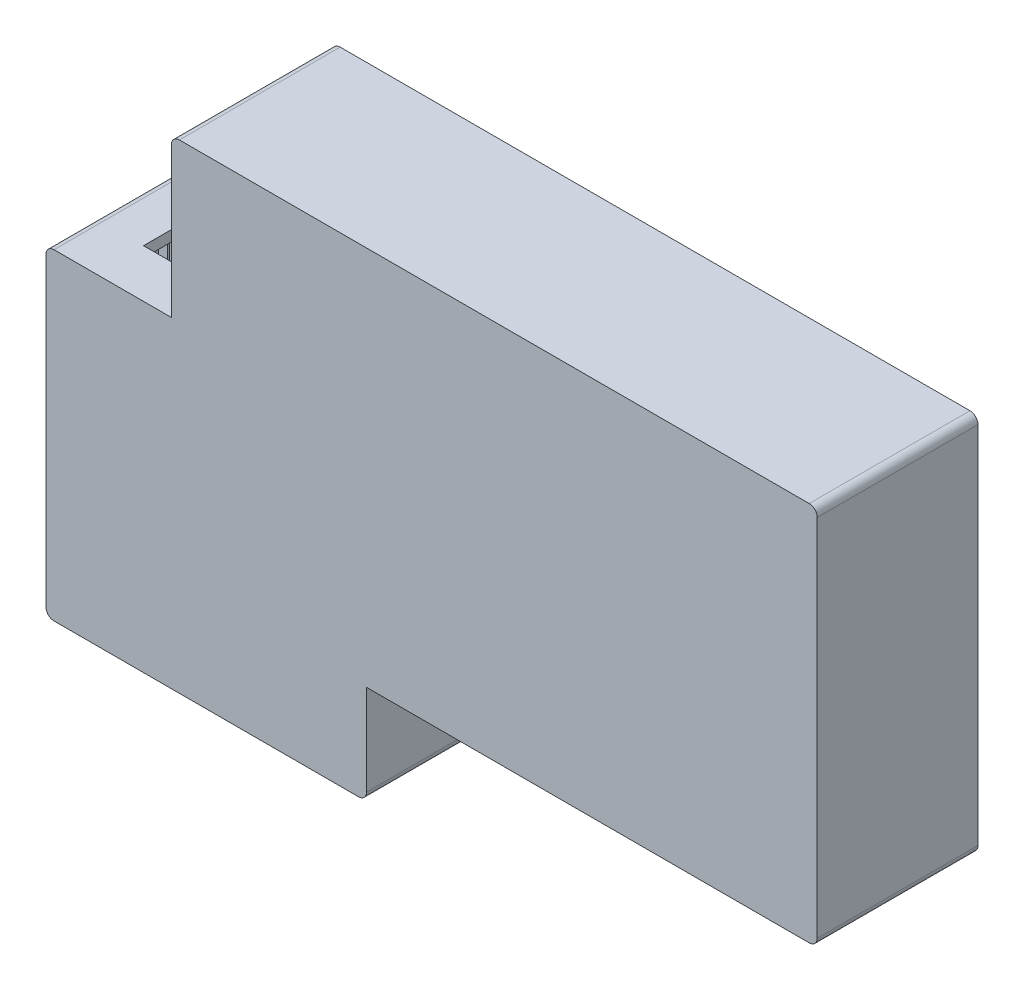
from build123d import *
from OCP.BRepFilletAPI import BRepFilletAPI_MakeChamfer

# Parameters (mm, degrees)
SKETCH1_R                = 2.5
SKETCH1_R_2              = 3.5
BASE_DEPTH               = 2
SKETCH1_3_R              = 0.75
SKETCH1_3_R_2            = 2.5
SKETCH1_3_R_3            = 1
SKETCH1_3_R_4            = 3.5
SKETCH1_3_R_5            = 1.25
PEGS_DEPTH               = 5
FILLET1_R                = 1.5
BOSS_EXTRUDE1_DEPTH      = 2
BOSS_EXTRUDE1_DEPTH_BACK = 9
BOSS_EXTRUDE2_START      = -9
BOSS_EXTRUDE2_DEPTH      = 2
BOSS_EXTRUDE3_START      = -8
BOSS_EXTRUDE3_DEPTH      = 8
FILLET2_R                = 1.5
CHAMFER1_SIZE            = 1
CHAMFER1_SIZE2           = 0.363970234
BOSS_EXTRUDE4_DEPTH      = 19
BOSS_EXTRUDE4_DEPTH_BACK = 9
BOSS_EXTRUDE5_START      = 19
BOSS_EXTRUDE5_DEPTH      = 2
CUT_EXTRUDE1_START       = -20.44
SKETCH2_W                = 13
SKETCH2_H                = 8
SKETCH2_R                = 5
CUT_EXTRUDE1_DEPTH       = 20.44
CUT_EXTRUDE2_START       = -60
SKETCH2_3_W              = 13
SKETCH2_3_H              = 8
CUT_EXTRUDE2_DEPTH       = 2
FILLET3_R                = 1.5
SKETCH3_W                = 3
SKETCH3_H                = 6
SKETCH3_H_2              = 5
SKETCH3_W_2              = 12
SKETCH3_H_3              = 3
SKETCH3_W_3              = 14
BOSS_EXTRUDE6_DEPTH      = 17


with BuildPart() as part:
    # Sketch1 → base (new body)
    with BuildSketch(Plane.XY):
        with BuildLine():
            Line((-33.06, 4.15), (-37.56, 4.15))
            Line((-37.56, 4.15), (-37.56, -47.85))
            Line((-37.56, -47.85), (12.255, -47.85))
            Line((12.255, -47.85), (12.255, -29.41))
            Line((12.255, -29.41), (98.36, -29.41))
            Line((98.36, -29.41), (98.36, 33.59))
            Line((98.36, 33.59), (-14.16, 33.59))
            Line((-14.16, 33.59), (-14.16, 4.15))
            Line((-14.16, 4.15), (-18.66, 4.15))
            ThreePointArc((-18.66, 4.15), (-20.16, -0.35), (-21.66, 4.15))
            Line((-21.66, 4.15), (-30.06, 4.15))
            ThreePointArc((-30.06, 4.15), (-31.56, -0.35), (-33.06, 4.15))
        make_face()
        with Locations((18.16, -25.41)):
            Circle(SKETCH1_R, mode=Mode.SUBTRACT)
        with Locations((94.36, -25.41)):
            Circle(SKETCH1_R, mode=Mode.SUBTRACT)
        with Locations((94.36, -9.41)):
            Circle(SKETCH1_R, mode=Mode.SUBTRACT)
        with Locations((79.16, 29.59)):
            Circle(SKETCH1_R_2, mode=Mode.SUBTRACT)
        with Locations((18.16, 29.59)):
            Circle(SKETCH1_R_2, mode=Mode.SUBTRACT)
        with Locations((10.16, 29.59)):
            Circle(SKETCH1_R, mode=Mode.SUBTRACT)
        with Locations((-10.16, 29.59)):
            Circle(SKETCH1_R, mode=Mode.SUBTRACT)
        with Locations((-10.16, 14.35)):
            Circle(SKETCH1_R, mode=Mode.SUBTRACT)
        with Locations((-10.16, 6.35)):
            Circle(SKETCH1_R, mode=Mode.SUBTRACT)
        with Locations((8.255, -44.85)):
            Circle(SKETCH1_R, mode=Mode.SUBTRACT)
        with Locations((-8.255, -44.85)):
            Circle(SKETCH1_R, mode=Mode.SUBTRACT)
        with Locations((-20.16, -44.85)):
            Circle(SKETCH1_R, mode=Mode.SUBTRACT)
        with Locations((-31.56, -44.85)):
            Circle(SKETCH1_R, mode=Mode.SUBTRACT)
        with Locations((79.16, -1.41)):
            Circle(SKETCH1_R_2, mode=Mode.SUBTRACT)
        with Locations((10.16, 14.35)):
            Circle(SKETCH1_R, mode=Mode.SUBTRACT)
        with Locations((10.16, 6.35)):
            Circle(SKETCH1_R, mode=Mode.SUBTRACT)
        with Locations((18.16, -1.41)):
            Circle(SKETCH1_R_2, mode=Mode.SUBTRACT)
        with Locations((10.16, -6.35)):
            Circle(SKETCH1_R, mode=Mode.SUBTRACT)
        with Locations((-10.16, -6.35)):
            Circle(SKETCH1_R, mode=Mode.SUBTRACT)
        with Locations((18.16, -9.41)):
            Circle(SKETCH1_R, mode=Mode.SUBTRACT)
        with Locations((-6.5, -14.35)):
            Circle(SKETCH1_R, mode=Mode.SUBTRACT)
        with Locations((6.5, -14.35)):
            Circle(SKETCH1_R, mode=Mode.SUBTRACT)
    extrude(amount=BASE_DEPTH)

    # Sketch1<3> → pegs (add)
    # profile 1 of 24: a face of its own
    with BuildSketch(Plane.XY):
        with BuildLine():
            Line((-30.06, 4.15), (-33.06, 4.15))
            ThreePointArc((-33.06, 4.15), (-31.56, -0.35), (-30.06, 4.15))
        make_face()
        with Locations((-31.56, 2.15)):
            Circle(SKETCH1_3_R, mode=Mode.SUBTRACT)
    # profile 2 of 24: a face of its own
    with BuildSketch(Plane.XY):
        with BuildLine():
            Line((-18.66, 4.15), (-21.66, 4.15))
            ThreePointArc((-21.66, 4.15), (-20.16, -0.35), (-18.66, 4.15))
        make_face()
        with Locations((-20.16, 2.15)):
            Circle(SKETCH1_3_R, mode=Mode.SUBTRACT)
    # profile 3 of 24: a face of its own
    with BuildSketch(Plane.XY):
        with Locations((-31.56, -44.85)):
            Circle(SKETCH1_3_R_2)
        with Locations((-31.56, -44.85)):
            Circle(SKETCH1_3_R, mode=Mode.SUBTRACT)
    # profile 4 of 24: a face of its own
    with BuildSketch(Plane.XY):
        with Locations((8.255, -44.85)):
            Circle(SKETCH1_3_R_2)
        with Locations((8.255, -44.85)):
            Circle(SKETCH1_3_R_3, mode=Mode.SUBTRACT)
    # profile 5 of 24: a face of its own
    with BuildSketch(Plane.XY):
        with Locations((-10.16, 6.35)):
            Circle(SKETCH1_3_R_2)
        with Locations((-10.16, 6.35)):
            Circle(SKETCH1_3_R_3, mode=Mode.SUBTRACT)
    # profile 6 of 24: a face of its own
    with BuildSketch(Plane.XY):
        with Locations((-20.16, -44.85)):
            Circle(SKETCH1_3_R_2)
        with Locations((-20.16, -44.85)):
            Circle(SKETCH1_3_R, mode=Mode.SUBTRACT)
    # profile 7 of 24: a face of its own
    with BuildSketch(Plane.XY):
        with BuildLine():
            ThreePointArc((19.66, -27.41), (18.16, -22.91), (16.66, -27.41))
            Line((16.66, -27.41), (19.66, -27.41))
        make_face()
        with Locations((18.16, -25.41)):
            Circle(SKETCH1_3_R, mode=Mode.SUBTRACT)
    # profile 8 of 24: a face of its own
    with BuildSketch(Plane.XY):
        with Locations((-8.255, -44.85)):
            Circle(SKETCH1_3_R_2)
        with Locations((-8.255, -44.85)):
            Circle(SKETCH1_3_R_3, mode=Mode.SUBTRACT)
    # profile 9 of 24: a face of its own
    with BuildSketch(Plane.XY):
        with Locations((-10.16, 14.35)):
            Circle(SKETCH1_3_R_2)
        with Locations((-10.16, 14.35)):
            Circle(SKETCH1_3_R_3, mode=Mode.SUBTRACT)
    # profile 10 of 24: a face of its own
    with BuildSketch(Plane.XY):
        with Locations((94.36, -25.41)):
            Circle(SKETCH1_3_R_2)
        with Locations((94.36, -25.41)):
            Circle(SKETCH1_3_R, mode=Mode.SUBTRACT)
    # profile 11 of 24: a face of its own
    with BuildSketch(Plane.XY):
        with Locations((-10.16, 29.59)):
            Circle(SKETCH1_3_R_2)
        with Locations((-10.16, 29.59)):
            Circle(SKETCH1_3_R_3, mode=Mode.SUBTRACT)
    # profile 12 of 24: a face of its own
    with BuildSketch(Plane.XY):
        with Locations((94.36, -9.41)):
            Circle(SKETCH1_3_R_2)
        with Locations((94.36, -9.41)):
            Circle(SKETCH1_3_R, mode=Mode.SUBTRACT)
    # profile 13 of 24: a face of its own
    with BuildSketch(Plane.XY):
        with Locations((10.16, 29.59)):
            Circle(SKETCH1_3_R_2)
        with Locations((10.16, 29.59)):
            Circle(SKETCH1_3_R_3, mode=Mode.SUBTRACT)
    # profile 14 of 24: a face of its own
    with BuildSketch(Plane.XY):
        with Locations((79.16, 29.59)):
            Circle(SKETCH1_3_R_4)
        with Locations((79.16, 29.59)):
            Circle(SKETCH1_3_R_5, mode=Mode.SUBTRACT)
    # profile 15 of 24: a face of its own
    with BuildSketch(Plane.XY):
        with Locations((18.16, 29.59)):
            Circle(SKETCH1_3_R_4)
        with Locations((18.16, 29.59)):
            Circle(SKETCH1_3_R_5, mode=Mode.SUBTRACT)
    # profile 16 of 24: a face of its own
    with BuildSketch(Plane.XY):
        with Locations((-6.5, -14.35)):
            Circle(SKETCH1_3_R_2)
        with Locations((-6.5, -14.35)):
            Circle(SKETCH1_3_R, mode=Mode.SUBTRACT)
    # profile 17 of 24: a face of its own
    with BuildSketch(Plane.XY):
        with Locations((6.5, -14.35)):
            Circle(SKETCH1_3_R_2)
        with Locations((6.5, -14.35)):
            Circle(SKETCH1_3_R, mode=Mode.SUBTRACT)
    # profile 18 of 24: a face of its own
    with BuildSketch(Plane.XY):
        with Locations((10.16, -6.35)):
            Circle(SKETCH1_3_R_2)
        with Locations((10.16, -6.35)):
            Circle(SKETCH1_3_R_3, mode=Mode.SUBTRACT)
    # profile 19 of 24: a face of its own
    with BuildSketch(Plane.XY):
        with Locations((-10.16, -6.35)):
            Circle(SKETCH1_3_R_2)
        with Locations((-10.16, -6.35)):
            Circle(SKETCH1_3_R_3, mode=Mode.SUBTRACT)
    # profile 20 of 24: a face of its own
    with BuildSketch(Plane.XY):
        with Locations((10.16, 6.35)):
            Circle(SKETCH1_3_R_2)
        with Locations((10.16, 6.35)):
            Circle(SKETCH1_3_R_3, mode=Mode.SUBTRACT)
    # profile 21 of 24: a face of its own
    with BuildSketch(Plane.XY):
        with Locations((10.16, 14.35)):
            Circle(SKETCH1_3_R_2)
        with Locations((10.16, 14.35)):
            Circle(SKETCH1_3_R_3, mode=Mode.SUBTRACT)
    # profile 22 of 24: a face of its own
    with BuildSketch(Plane.XY):
        with Locations((18.16, -1.41)):
            Circle(SKETCH1_3_R_4)
        with Locations((18.16, -1.41)):
            Circle(SKETCH1_3_R_5, mode=Mode.SUBTRACT)
    # profile 23 of 24: a face of its own
    with BuildSketch(Plane.XY):
        with Locations((79.16, -1.41)):
            Circle(SKETCH1_3_R_4)
        with Locations((79.16, -1.41)):
            Circle(SKETCH1_3_R_5, mode=Mode.SUBTRACT)
    # profile 24 of 24: a face of its own
    with BuildSketch(Plane.XY):
        with Locations((18.16, -9.41)):
            Circle(SKETCH1_3_R_2)
        with Locations((18.16, -9.41)):
            Circle(SKETCH1_3_R, mode=Mode.SUBTRACT)
    extrude(amount=PEGS_DEPTH)

    # Fillet1
    fillet1_edges = [part.edges().sort_by_distance(p)[0] for p in [
        (-30.06, 4.15, 3.5),
        (-33.06, 4.15, 3.5),
        (-18.66, 4.15, 3.5),
        (-21.66, 4.15, 3.5),
        (-14.16, 33.59, 1),
        (98.36, 33.59, 1),
        (98.36, -29.41, 1),
        (12.255, -47.85, 1),
        (-37.56, -47.85, 1),
        (-37.56, 4.15, 1),
    ]]
    fillet(fillet1_edges, radius=FILLET1_R)


with BuildPart() as body_2:
    # Sketch1<4> → Boss-Extrude1 (new, two sides: drawn at the far end of the back side and taken through both)
    with BuildSketch(Plane.XY.offset(-BOSS_EXTRUDE1_DEPTH_BACK)):
        Polygon((16.255, -31.41), (100.36, -31.41), (100.36, 35.59), (-16.16, 35.59), (-16.16, 6.15), (-39.56, 6.15), (-39.56, -49.85), (14.255, -49.85), (14.255, -41.85), (16.255, -41.85), align=None)
        Polygon((-37.56, -47.85), (-37.56, 4.15), (-14.16, 4.15), (-14.16, 33.59), (98.36, 33.59), (98.36, -29.41), (12.255, -29.41), (12.255, -31.41), (14.255, -31.41), (14.255, -39.85), (12.255, -39.85), (12.255, -47.85), align=None, mode=Mode.SUBTRACT)
    extrude(amount=BOSS_EXTRUDE1_DEPTH + BOSS_EXTRUDE1_DEPTH_BACK)

    # Boss-Extrude2: read off the stored shape, not the designer's step
    # Boss-Extrude2 outline → Boss-Extrude2 (add)
    with BuildSketch(Plane.XY.offset(BOSS_EXTRUDE2_START)):
        Polygon((14.255, -31.41), (12.255, -31.41), (12.255, -29.41), (98.36, -29.41), (98.36, 33.59), (-14.16, 33.59), (-14.16, 4.15), (-37.56, 4.15), (-37.56, -47.85), (12.255, -47.85), (12.255, -39.85), (14.255, -39.85), align=None)
    extrude(amount=BOSS_EXTRUDE2_DEPTH)

    # Boss-Extrude3: read off the stored shape, not the designer's step
    # Boss-Extrude3 outline → Boss-Extrude3 (add)
    with BuildSketch(Plane.XY.offset(BOSS_EXTRUDE3_START)):
        Polygon((10.255, -27.41), (10.255, -31.41), (12.255, -31.41), (12.255, -29.41), (98.36, -29.41), (98.36, 33.59), (-14.16, 33.59), (-14.16, 4.15), (-37.56, 4.15), (-37.56, -47.85), (12.255, -47.85), (12.255, -39.85), (10.255, -39.85), (10.255, -45.85), (-35.56, -45.85), (-35.56, 2.15), (-12.16, 2.15), (-12.16, 31.59), (96.36, 31.59), (96.36, -27.41), align=None)
    extrude(amount=BOSS_EXTRUDE3_DEPTH)

    # Fillet2
    fillet2_edges = [body_2.edges().sort_by_distance(p)[0] for p in [
        (100.36, -31.41, -3.5),
        (100.36, 35.59, -3.5),
        (-16.16, 35.59, -3.5),
        (-39.56, 6.15, -3.5),
        (12.255, -47.85, 1),
        (-37.56, -47.85, 1),
        (-37.56, 4.15, 1),
        (-14.16, 33.59, 1),
        (98.36, 33.59, 1),
        (98.36, -29.41, 1),
        (-39.56, -49.85, -3.5),
        (14.255, -49.85, -3.5),
    ]]
    fillet(fillet2_edges, radius=FILLET2_R)

    # Chamfer1: one chamfer whose edges measure the first distance from different faces: ONE call of the kernel's chamfer builder (chamfer() names one face for all edges)
    chamfer1_edges_1 = [body_2.edges().sort_by_distance(p)[0] for p in [
        (12.255, -43.1, 2),
    ]]
    chamfer1_side_1 = [body_2.faces().sort_by_distance(p)[0] for p in [
        (12.255, -43.1, 1),
    ]]
    chamfer1_edges_2 = [body_2.edges().sort_by_distance(p)[0] for p in [
        (-12.6525, -47.85, 2),
    ]]
    chamfer1_side_2 = [body_2.faces().sort_by_distance(p)[0] for p in [
        (-12.6525, -47.85, 1),
    ]]
    chamfer1_edges_3 = [body_2.edges().sort_by_distance(p)[0] for p in [
        (-37.56, -21.85, 2),
    ]]
    chamfer1_side_3 = [body_2.faces().sort_by_distance(p)[0] for p in [
        (-37.56, -21.85, 1),
    ]]
    chamfer1_edges_4 = [body_2.edges().sort_by_distance(p)[0] for p in [
        (-14.16, 18.12, 2),
    ]]
    chamfer1_side_4 = [body_2.faces().sort_by_distance(p)[0] for p in [
        (-14.16, 18.12, 1),
    ]]
    chamfer1_edges_5 = [body_2.edges().sort_by_distance(p)[0] for p in [
        (42.1, 33.59, 2),
    ]]
    chamfer1_side_5 = [body_2.faces().sort_by_distance(p)[0] for p in [
        (42.1, 33.59, 1),
    ]]
    chamfer1_edges_6 = [body_2.edges().sort_by_distance(p)[0] for p in [
        (98.36, 2.09, 2),
    ]]
    chamfer1_side_6 = [body_2.faces().sort_by_distance(p)[0] for p in [
        (98.36, 2.09, 1),
    ]]
    chamfer1_edges_7 = [body_2.edges().sort_by_distance(p)[0] for p in [
        (97.920660172, 33.150660172, 2),
    ]]
    chamfer1_side_7 = [body_2.faces().sort_by_distance(p)[0] for p in [
        (97.920660172, 33.150660172, 1),
    ]]
    chamfer1_edges_8 = [body_2.edges().sort_by_distance(p)[0] for p in [
        (97.920660172, -28.970660172, 2),
    ]]
    chamfer1_side_8 = [body_2.faces().sort_by_distance(p)[0] for p in [
        (97.920660172, -28.970660172, 1),
    ]]
    chamfer1_edges_9 = [body_2.edges().sort_by_distance(p)[0] for p in [
        (11.815660172, -47.410660172, 2),
    ]]
    chamfer1_side_9 = [body_2.faces().sort_by_distance(p)[0] for p in [
        (11.815660172, -47.410660172, 1),
    ]]
    chamfer1_edges_10 = [body_2.edges().sort_by_distance(p)[0] for p in [
        (-37.120660172, -47.410660172, 2),
    ]]
    chamfer1_side_10 = [body_2.faces().sort_by_distance(p)[0] for p in [
        (-37.120660172, -47.410660172, 1),
    ]]
    chamfer1_edges_11 = [body_2.edges().sort_by_distance(p)[0] for p in [
        (-13.720660172, 33.150660172, 2),
    ]]
    chamfer1_side_11 = [body_2.faces().sort_by_distance(p)[0] for p in [
        (-13.720660172, 33.150660172, 1),
    ]]
    chamfer1_edges_12 = [body_2.edges().sort_by_distance(p)[0] for p in [
        (-37.120660172, 3.710660172, 2),
    ]]
    chamfer1_side_12 = [body_2.faces().sort_by_distance(p)[0] for p in [
        (-37.120660172, 3.710660172, 1),
    ]]
    chamfer1_edges_13 = [body_2.edges().sort_by_distance(p)[0] for p in [
        (-25.11, 4.15, 2),
    ]]
    chamfer1_side_13 = [body_2.faces().sort_by_distance(p)[0] for p in [
        (-25.11, 4.15, 1),
    ]]
    chamfer1_edges_14 = [body_2.edges().sort_by_distance(p)[0] for p in [
        (54.5575, -29.41, 2),
    ]]
    chamfer1_side_14 = [body_2.faces().sort_by_distance(p)[0] for p in [
        (54.5575, -29.41, 1),
    ]]
    chamfer1_edges_15 = [body_2.edges().sort_by_distance(p)[0] for p in [
        (12.255, -30.41, 2),
    ]]
    chamfer1_side_15 = [body_2.faces().sort_by_distance(p)[0] for p in [
        (12.255, -30.41, 1),
    ]]
    chamfer1 = BRepFilletAPI_MakeChamfer(body_2.part.solid().wrapped)
    for e in chamfer1_edges_1:
        chamfer1.Add(CHAMFER1_SIZE, CHAMFER1_SIZE2, e.wrapped, chamfer1_side_1[0].wrapped)  # the first distance lies on this face
    for e in chamfer1_edges_2:
        chamfer1.Add(CHAMFER1_SIZE, CHAMFER1_SIZE2, e.wrapped, chamfer1_side_2[0].wrapped)  # the first distance lies on this face
    for e in chamfer1_edges_3:
        chamfer1.Add(CHAMFER1_SIZE, CHAMFER1_SIZE2, e.wrapped, chamfer1_side_3[0].wrapped)  # the first distance lies on this face
    for e in chamfer1_edges_4:
        chamfer1.Add(CHAMFER1_SIZE, CHAMFER1_SIZE2, e.wrapped, chamfer1_side_4[0].wrapped)  # the first distance lies on this face
    for e in chamfer1_edges_5:
        chamfer1.Add(CHAMFER1_SIZE, CHAMFER1_SIZE2, e.wrapped, chamfer1_side_5[0].wrapped)  # the first distance lies on this face
    for e in chamfer1_edges_6:
        chamfer1.Add(CHAMFER1_SIZE, CHAMFER1_SIZE2, e.wrapped, chamfer1_side_6[0].wrapped)  # the first distance lies on this face
    for e in chamfer1_edges_7:
        chamfer1.Add(CHAMFER1_SIZE, CHAMFER1_SIZE2, e.wrapped, chamfer1_side_7[0].wrapped)  # the first distance lies on this face
    for e in chamfer1_edges_8:
        chamfer1.Add(CHAMFER1_SIZE, CHAMFER1_SIZE2, e.wrapped, chamfer1_side_8[0].wrapped)  # the first distance lies on this face
    for e in chamfer1_edges_9:
        chamfer1.Add(CHAMFER1_SIZE, CHAMFER1_SIZE2, e.wrapped, chamfer1_side_9[0].wrapped)  # the first distance lies on this face
    for e in chamfer1_edges_10:
        chamfer1.Add(CHAMFER1_SIZE, CHAMFER1_SIZE2, e.wrapped, chamfer1_side_10[0].wrapped)  # the first distance lies on this face
    for e in chamfer1_edges_11:
        chamfer1.Add(CHAMFER1_SIZE, CHAMFER1_SIZE2, e.wrapped, chamfer1_side_11[0].wrapped)  # the first distance lies on this face
    for e in chamfer1_edges_12:
        chamfer1.Add(CHAMFER1_SIZE, CHAMFER1_SIZE2, e.wrapped, chamfer1_side_12[0].wrapped)  # the first distance lies on this face
    for e in chamfer1_edges_13:
        chamfer1.Add(CHAMFER1_SIZE, CHAMFER1_SIZE2, e.wrapped, chamfer1_side_13[0].wrapped)  # the first distance lies on this face
    for e in chamfer1_edges_14:
        chamfer1.Add(CHAMFER1_SIZE, CHAMFER1_SIZE2, e.wrapped, chamfer1_side_14[0].wrapped)  # the first distance lies on this face
    for e in chamfer1_edges_15:
        chamfer1.Add(CHAMFER1_SIZE, CHAMFER1_SIZE2, e.wrapped, chamfer1_side_15[0].wrapped)  # the first distance lies on this face
    add(Compound.cast(chamfer1.Shape()), mode=Mode.REPLACE)


with BuildPart() as body_3:
    # Sketch1<7> → Boss-Extrude4 (new, two sides: drawn at the far end of the back side and taken through both)
    with BuildSketch(Plane.XY.offset(-BOSS_EXTRUDE4_DEPTH_BACK)):
        Polygon((16.255, -49.85), (14.255, -49.85), (-39.56, -49.85), (-39.56, 6.15), (-16.16, 6.15), (-16.16, 35.59), (100.36, 35.59), (100.36, -31.41), (16.255, -31.41), (16.255, -33.41), (18.255, -33.41), (102.36, -33.41), (102.36, 37.59), (-18.16, 37.59), (-18.16, 8.15), (-41.56, 8.15), (-41.56, -51.85), (16.255, -51.85), align=None)
        Polygon((16.255, -33.41), (16.255, -41.85), (16.255, -49.85), (16.255, -51.85), (18.255, -51.85), (18.255, -33.41), align=None)
    extrude(amount=BOSS_EXTRUDE4_DEPTH + BOSS_EXTRUDE4_DEPTH_BACK)

    # Boss-Extrude5: read off the stored shape, not the designer's step
    # Boss-Extrude5 outline → Boss-Extrude5 (add)
    with BuildSketch(Plane.XY.offset(BOSS_EXTRUDE5_START)):
        Polygon((-41.56, -51.85), (18.255, -51.85), (18.255, -33.41), (102.36, -33.41), (102.36, 37.59), (-18.16, 37.59), (-18.16, 8.15), (-41.56, 8.15), align=None)
    extrude(amount=BOSS_EXTRUDE5_DEPTH)

    # Sketch2 → Cut-Extrude1 (cut)
    with BuildSketch(Plane.XZ.offset(51.85).offset(CUT_EXTRUDE1_START)):
        with Locations((0, 8)):
            Rectangle(SKETCH2_W, SKETCH2_H)
        with Locations(Location((70.36, 13.5, 0), (0, 0, 270))):
            Circle(SKETCH2_R)
    extrude(amount=CUT_EXTRUDE1_DEPTH, mode=Mode.SUBTRACT)

    # Sketch2<3> → Cut-Extrude2 (cut)
    with BuildSketch(Plane.XZ.offset(51.85).offset(CUT_EXTRUDE2_START)):
        with Locations((-25.86, 8)):
            Rectangle(SKETCH2_3_W, SKETCH2_3_H)
    extrude(amount=CUT_EXTRUDE2_DEPTH, mode=Mode.SUBTRACT)

    # Fillet3
    fillet3_edges = [body_3.edges().sort_by_distance(p)[0] for p in [
        (16.255, -49.85, 5),
        (100.36, -31.41, 5),
        (100.36, 35.59, 5),
        (-16.16, 35.59, 5),
        (-39.56, 6.15, 5),
        (-39.56, -49.85, 5),
        (18.255, -51.85, 6),
        (-41.56, -51.85, 6),
        (-41.56, 8.15, 6),
        (-18.16, 37.59, 6),
        (102.36, 37.59, 6),
        (102.36, -33.41, 6),
    ]]
    fillet(fillet3_edges, radius=FILLET3_R)

    # Sketch3 → Boss-Extrude6 (add)
    with BuildSketch(Plane(origin=(0, 0, 19), x_dir=(-1, 0, 0), z_dir=(0, 0, -1))):
        with Locations((38.06, -18.85)):
            Rectangle(SKETCH3_W, SKETCH3_H)
        with Locations((38.06, -24.85)):
            Rectangle(SKETCH3_W, SKETCH3_H)
        with Locations((13.06, -47.35)):
            Rectangle(SKETCH3_W, SKETCH3_H_2)
        with Locations((-22.255, -29.91)):
            Rectangle(SKETCH3_W_2, SKETCH3_H_3)
        with Locations((-90.36, 32.59)):
            Rectangle(SKETCH3_W_3, SKETCH3_H)
        with BuildLine():
            ThreePointArc((-100.36, -29.91), (-99.920660172, -30.970660172), (-98.86, -31.41))
            Line((-98.86, -31.41), (-97.36, -31.41))
            Line((-97.36, -31.41), (-97.36, 29.59))
            Line((-97.36, 29.59), (-97.36, 35.59))
            Line((-97.36, 35.59), (-98.86, 35.59))
            ThreePointArc((-98.86, 35.59), (-99.920660172, 35.150660172), (-100.36, 34.09))
            Line((-100.36, 34.09), (-100.36, -29.91))
        make_face()
        with BuildLine():
            Line((14.66, 35.59), (13.16, 35.59))
            Line((13.16, 35.59), (13.16, 23.59))
            Line((13.16, 23.59), (16.16, 23.59))
            Line((16.16, 23.59), (16.16, 34.09))
            ThreePointArc((16.16, 34.09), (15.720660172, 35.150660172), (14.66, 35.59))
        make_face()
    extrude(amount=BOSS_EXTRUDE6_DEPTH)


solid = Compound([part.part, body_2.part, body_3.part])
